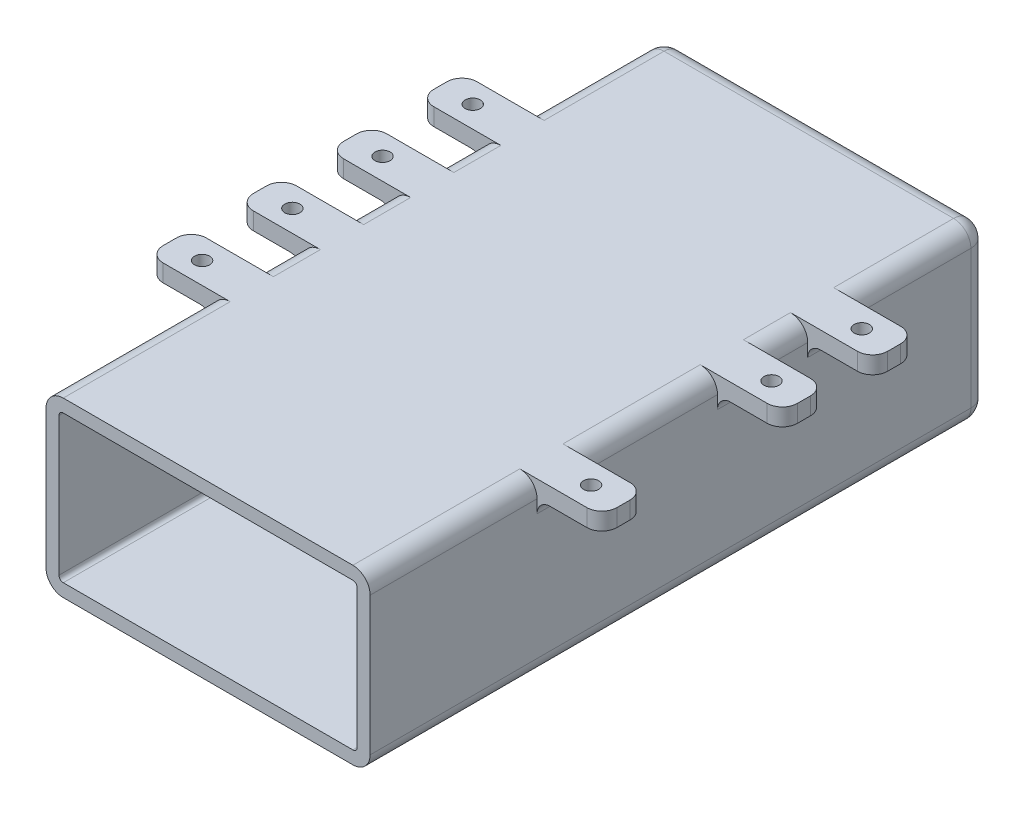
from build123d import *

# Parameters (mm, degrees)
ESQUISSE1_W             = 69
ESQUISSE1_H             = 34
BOSS_EXTRU_1_DEPTH      = 140
COQUE1_T                = 3
CONG_3_R                = 4
ESQUISSE2_W             = 19
ESQUISSE2_H             = 10
ESQUISSE2_R             = 1.75
BOSS_EXTRU_2_DEPTH      = 4
CONG_5_R                = 3.5
ESQUISSE1_2_W           = 69
ESQUISSE1_2_H           = 34
ENL_V_MAT_EXTRU_1_DEPTH = 140
CONG_4_R                = 1
CONG_7_R                = 3
ENL_V_MAT_EXTRU_2_REACH = 155.64
ESQUISSE3_W             = 61
ESQUISSE3_H             = 26
CONG_8_R                = 1


with BuildPart() as part:
    # Esquisse1 → Boss.-Extru.1 (new body)
    with BuildSketch(Plane.XY):
        Rectangle(ESQUISSE1_W, ESQUISSE1_H)
    extrude(amount=BOSS_EXTRU_1_DEPTH)

    # Coque1
    coque1_openings = [part.faces().sort_by_distance(p)[0] for p in [
        (0, 0, 140),
    ]]
    offset(amount=COQUE1_T, openings=coque1_openings, kind=Kind.INTERSECTION)

    # Congé3
    # the kernel refuses this fillet: 4 mm, written as the material it takes off along each edge
    with BuildSketch(Plane(origin=(33.5, 16, 1), x_dir=(0, 1, 0), z_dir=(0, 0, -1))) as cong_3_piece_1_section:
        Polygon((0, 0), (CONG_3_R, 0), (CONG_3_R, CONG_3_R), (0, CONG_3_R), align=None)
    cong_3_piece_1 = extrude(amount=CONG_3_R, mode=Mode.PRIVATE)
    cong_3_piece_1 = cong_3_piece_1 - Plane(origin=(33.5, 16, 1), x_dir=(-0.7071067811865475, -0.7071067811865475, 0), z_dir=(0, 0, -1)) * Sphere(CONG_3_R, mode=Mode.PRIVATE)
    add(cong_3_piece_1, mode=Mode.SUBTRACT)
    with BuildSketch(Plane(origin=(-33.5, 16, 1), x_dir=(0, 0, -1), z_dir=(-1, 0, 0))) as cong_3_piece_2_section:
        Polygon((0, 0), (CONG_3_R, 0), (CONG_3_R, -CONG_3_R), (0, -CONG_3_R), align=None)
    cong_3_piece_2 = extrude(amount=CONG_3_R, mode=Mode.PRIVATE)
    cong_3_piece_2 = cong_3_piece_2 - Plane(origin=(-33.5, 16, 1), x_dir=(0, -0.7071067811865475, 0.7071067811865475), z_dir=(-1, 0, 0)) * Sphere(CONG_3_R, mode=Mode.PRIVATE)
    add(cong_3_piece_2, mode=Mode.SUBTRACT)
    with BuildSketch(Plane(origin=(33.5, -16, 1), x_dir=(0, 0, -1), z_dir=(0, -1, 0))) as cong_3_piece_3_section:
        Polygon((0, 0), (CONG_3_R, 0), (CONG_3_R, CONG_3_R), (0, CONG_3_R), align=None)
    cong_3_piece_3 = extrude(amount=CONG_3_R, mode=Mode.PRIVATE)
    cong_3_piece_3 = cong_3_piece_3 - Plane(origin=(33.5, -16, 1), x_dir=(-0.7071067811865475, 0, 0.7071067811865475), z_dir=(0, -1, 0)) * Sphere(CONG_3_R, mode=Mode.PRIVATE)
    add(cong_3_piece_3, mode=Mode.SUBTRACT)
    with BuildSketch(Plane(origin=(-33.5, -16, 1), x_dir=(-1, 0, 0), z_dir=(0, -1, 0))) as cong_3_piece_4_section:
        Polygon((0, 0), (CONG_3_R, 0), (CONG_3_R, CONG_3_R), (0, CONG_3_R), align=None)
    cong_3_piece_4 = extrude(amount=CONG_3_R, mode=Mode.PRIVATE)
    cong_3_piece_4 = cong_3_piece_4 - Plane(origin=(-33.5, -16, 1), x_dir=(0.7071067811865475, 0, 0.7071067811865475), z_dir=(0, -1, 0)) * Sphere(CONG_3_R, mode=Mode.PRIVATE)
    add(cong_3_piece_4, mode=Mode.SUBTRACT)
    with BuildSketch(Plane(origin=(33.5, 20, -3), x_dir=(0, 0, 1), z_dir=(-1, 0, 0)), Plane(origin=(-33.5, -20, -3), x_dir=(0, 0, 1), z_dir=(1, 0, 0))) as cong_3_piece_5:
        with BuildLine():
            CenterArc((CONG_3_R, -CONG_3_R), CONG_3_R, 90, 90)
            Line((0, -CONG_3_R), (0, 0))
            Line((0, 0), (CONG_3_R, 0))
        make_face()
    extrude(amount=67, mode=Mode.SUBTRACT)
    with BuildSketch(Plane(origin=(37.5, -16, -3), x_dir=(0, 0, 1), z_dir=(0, 1, 0)), Plane(origin=(-37.5, 16, -3), x_dir=(0, 0, 1), z_dir=(0, -1, 0))) as cong_3_piece_6:
        with BuildLine():
            CenterArc((CONG_3_R, -CONG_3_R), CONG_3_R, 90, 90)
            Line((0, -CONG_3_R), (0, 0))
            Line((0, 0), (CONG_3_R, 0))
        make_face()
    extrude(amount=32, mode=Mode.SUBTRACT)
    with BuildSketch(Plane(origin=(-37.5, 20, 1), x_dir=(1, 0, 0), z_dir=(0, 0, 1)), Plane(origin=(37.5, 20, 150), x_dir=(-1, 0, 0), z_dir=(0, 0, -1)), Plane(origin=(37.5, -20, 150), x_dir=(0, 1, 0), z_dir=(0, 0, -1)), Plane(origin=(-37.5, -20, 150), x_dir=(1, 0, 0), z_dir=(0, 0, -1))) as cong_3_piece_7:
        with BuildLine():
            CenterArc((CONG_3_R, -CONG_3_R), CONG_3_R, 90, 90)
            Line((0, -CONG_3_R), (0, 0))
            Line((0, 0), (CONG_3_R, 0))
        make_face()
    extrude(amount=149, mode=Mode.SUBTRACT)

    # Esquisse2 → Boss.-Extru.2 (add)
    # profile 1 of 7: a face of its own
    with BuildSketch(Plane(origin=(0, 20, 0), x_dir=(1, 0, 0), z_dir=(0, 1, 0))):
        with Locations((-43, -33.75)):
            Rectangle(ESQUISSE2_W, ESQUISSE2_H)
        with Locations(Location((-45, -33.75, 0), (0, 0, 270))):
            Circle(ESQUISSE2_R, mode=Mode.SUBTRACT)
    # profile 2 of 7: a face of its own
    with BuildSketch(Plane(origin=(0, 20, 0), x_dir=(1, 0, 0), z_dir=(0, 1, 0))):
        with Locations((-43, -54.625)):
            Rectangle(ESQUISSE2_W, ESQUISSE2_H)
        with Locations(Location((-45, -54.625, 0), (0, 0, 270))):
            Circle(ESQUISSE2_R, mode=Mode.SUBTRACT)
    # profile 3 of 7: a face of its own
    with BuildSketch(Plane(origin=(0, 20, 0), x_dir=(1, 0, 0), z_dir=(0, 1, 0))):
        with Locations((43, -33.75)):
            Rectangle(ESQUISSE2_W, ESQUISSE2_H)
        with Locations(Location((45, -33.75, 0), (0, 0, 270))):
            Circle(ESQUISSE2_R, mode=Mode.SUBTRACT)
    # profile 4 of 7: a face of its own
    with BuildSketch(Plane(origin=(0, 20, 0), x_dir=(1, 0, 0), z_dir=(0, 1, 0))):
        with Locations((-43, -75.5)):
            Rectangle(ESQUISSE2_W, ESQUISSE2_H)
        with Locations(Location((-45, -75.5, 0), (0, 0, 270))):
            Circle(ESQUISSE2_R, mode=Mode.SUBTRACT)
    # profile 5 of 7: a face of its own
    with BuildSketch(Plane(origin=(0, 20, 0), x_dir=(1, 0, 0), z_dir=(0, 1, 0))):
        with Locations((43, -54.625)):
            Rectangle(ESQUISSE2_W, ESQUISSE2_H)
        with Locations(Location((45, -54.625, 0), (0, 0, 270))):
            Circle(ESQUISSE2_R, mode=Mode.SUBTRACT)
    # profile 6 of 7: a face of its own
    with BuildSketch(Plane(origin=(0, 20, 0), x_dir=(1, 0, 0), z_dir=(0, 1, 0))):
        with Locations((-43, -96.375)):
            Rectangle(ESQUISSE2_W, ESQUISSE2_H)
        with Locations(Location((-45, -96.375, 0), (0, 0, 270))):
            Circle(ESQUISSE2_R, mode=Mode.SUBTRACT)
    # profile 7 of 7: a face of its own
    with BuildSketch(Plane(origin=(0, 20, 0), x_dir=(1, 0, 0), z_dir=(0, 1, 0))):
        with Locations((43, -96.375)):
            Rectangle(ESQUISSE2_W, ESQUISSE2_H)
        with Locations(Location((45, -96.375, 0), (0, 0, 270))):
            Circle(ESQUISSE2_R, mode=Mode.SUBTRACT)
    extrude(amount=-BOSS_EXTRU_2_DEPTH)

    # Congé5
    cong_5_edges = [part.edges().sort_by_distance(p)[0] for p in [
        (52.5, 18, 28.75),
        (52.5, 18, 38.75),
        (52.5, 18, 49.625),
        (52.5, 18, 59.625),
        (-52.5, 18, 91.375),
        (-52.5, 18, 101.375),
        (-52.5, 18, 80.5),
        (-52.5, 18, 70.5),
        (52.5, 18, 91.375),
        (52.5, 18, 101.375),
        (-52.5, 18, 28.75),
        (-52.5, 18, 38.75),
        (-52.5, 18, 49.625),
        (-52.5, 18, 59.625),
    ]]
    fillet(cong_5_edges, radius=CONG_5_R)

    # Esquisse1<2> → Enlèv. mat.-Extru.1 (cut)
    with BuildSketch(Plane.XY):
        Rectangle(ESQUISSE1_2_W, ESQUISSE1_2_H)
    extrude(amount=ENL_V_MAT_EXTRU_1_DEPTH, mode=Mode.SUBTRACT)

    # Congé4
    cong_4_edges = [part.edges().sort_by_distance(p)[0] for p in [
        (-34.5, 0, 0),
        (-34.5, 17, 70),
        (0, -17, 0),
        (-34.5, -17, 70),
        (34.5, 0, 0),
        (34.5, -17, 70),
        (0, 17, 0),
        (34.5, 17, 70),
    ]]
    fillet(cong_4_edges, radius=CONG_4_R)

    # Congé7
    # the kernel refuses this fillet: 3 mm, written as the material it adds along each edge
    with BuildSketch(Plane(origin=(37.5, 16, 38.75), x_dir=(0, -1, 0), z_dir=(0, 0, -1)), Plane(origin=(37.5, 16, 59.625), x_dir=(0, -1, 0), z_dir=(0, 0, -1)), Plane(origin=(-37.5, 16, 91.375), x_dir=(0, -1, 0), z_dir=(0, 0, 1)), Plane(origin=(-37.5, 16, 70.5), x_dir=(0, -1, 0), z_dir=(0, 0, 1)), Plane(origin=(37.5, 16, 101.375), x_dir=(0, -1, 0), z_dir=(0, 0, -1)), Plane(origin=(-37.5, 16, 28.75), x_dir=(0, -1, 0), z_dir=(0, 0, 1)), Plane(origin=(-37.5, 16, 49.625), x_dir=(0, -1, 0), z_dir=(0, 0, 1))) as cong_7_piece_1:
        with BuildLine():
            CenterArc((CONG_7_R, -CONG_7_R), CONG_7_R, 90, 90)
            Line((0, -CONG_7_R), (0, 0))
            Line((0, 0), (CONG_7_R, 0))
        make_face()
    extrude(amount=10)

    # Esquisse3 → Enlèv. mat.-Extru.2 (cut, up to next)
    with BuildSketch(Plane(origin=(0, 0, -3), x_dir=(-1, 0, 0), z_dir=(0, 0, -1)), mode=Mode.PRIVATE) as enl_v_mat_extru_2_sk1:
        Rectangle(ESQUISSE3_W, ESQUISSE3_H)
    enl_v_mat_extru_2_tool1 = extrude(enl_v_mat_extru_2_sk1.sketch, amount=-ENL_V_MAT_EXTRU_2_REACH, mode=Mode.PRIVATE) & part.part
    add(enl_v_mat_extru_2_tool1.solids().sort_by_distance((0, 0, -3))[0], mode=Mode.SUBTRACT)

    # Congé8
    cong_8_edges = [part.edges().sort_by_distance(p)[0] for p in [
        (30.5, -13, -1.5),
        (30.5, 13, -1.5),
        (-30.5, 13, -1.5),
        (-30.5, -13, -1.5),
    ]]
    fillet(cong_8_edges, radius=CONG_8_R)


solid = part.part
